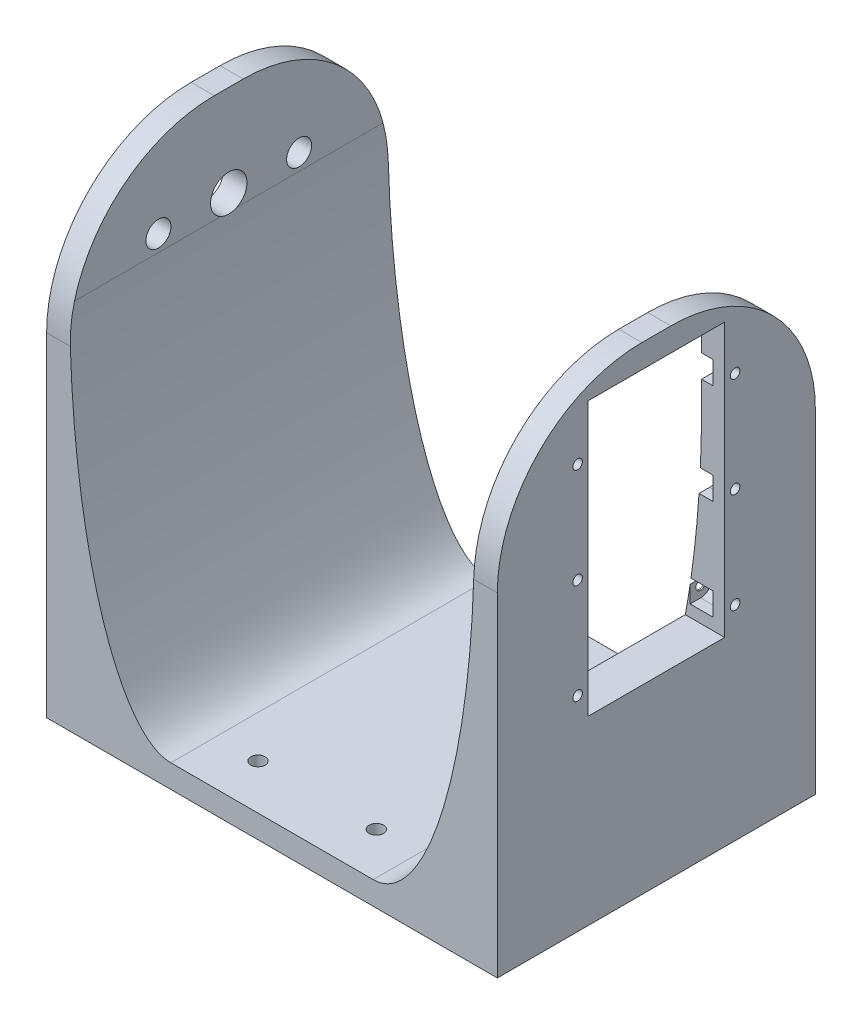
from build123d import *

# Parameters (mm, degrees)
SKETCH1_W               = 99
SKETCH1_H               = 69.85
BOSS_EXTRUDE1_DEPTH     = 105
CUT_EXTRUDE1_DEPTH      = 136.477941009
CUT_EXTRUDE2_REACH      = 123.223
SKETCH3_R               = 1.5875
FILLET1_R               = 31.75
CUT_EXTRUDE3_REACH      = 150.478
SKETCH4_R               = 1.05
SKETCH4_W               = 30
SKETCH4_H               = 60
CUT_EXTRUDE4_REACH      = 150.478
SKETCH6_R               = 4
SKETCH6_R_2             = 2.75
CUT_EXTRUDE5_DEPTH      = 2.5
CUT_EXTRUDE5_DEPTH_BACK = 2.5


with BuildPart() as part:
    # Sketch1 → Boss-Extrude1 (new body)
    with BuildSketch(Plane(origin=(0, 0, 0), x_dir=(1, 0, 0), z_dir=(0, 1, 0))):
        Rectangle(SKETCH1_W, SKETCH1_H)
    extrude(amount=BOSS_EXTRUDE1_DEPTH)

    # Sketch2 → Cut-Extrude1 (cut, through all)
    with BuildSketch(Plane.XY.offset(34.925)):
        with BuildLine():
            Line((-44.42, 105), (44.42, 105))
            Line((44.42, 105), (44.42, 81.28))
            add(Edge.make_bspline(
                [(22.225, 5.08), (44.42, 5.08), (44.42, 81.28)],
                knots=[0, 0, 0, 1.570796327, 1.570796327, 1.570796327], degree=2, weights=[1, 0.707106781, 1]))
            Line((22.225, 5.08), (-22.225, 5.08))
            add(Edge.make_bspline(
                [(-44.42, 81.28), (-44.42, 5.08), (-22.225, 5.08)],
                knots=[1.570796327, 1.570796327, 1.570796327, 3.141592654, 3.141592654, 3.141592654], degree=2, weights=[1, 0.707106781, 1]))
            Line((-44.42, 81.28), (-44.42, 105))
        make_face()
    extrude(amount=-CUT_EXTRUDE1_DEPTH, mode=Mode.SUBTRACT)

    # Sketch3 → Cut-Extrude2 (cut, up to next)
    with BuildSketch(Plane.XZ, mode=Mode.PRIVATE) as cut_extrude2_sk1:
        with Locations((-13, -25)):
            Circle(SKETCH3_R)
    cut_extrude2_tool1 = extrude(cut_extrude2_sk1.sketch, amount=-CUT_EXTRUDE2_REACH, mode=Mode.PRIVATE) & part.part
    # Sketch3 → Cut-Extrude2 (cut, up to next)
    with BuildSketch(Plane.XZ, mode=Mode.PRIVATE) as cut_extrude2_sk2:
        with Locations((-13, 25)):
            Circle(SKETCH3_R)
    cut_extrude2_tool2 = extrude(cut_extrude2_sk2.sketch, amount=-CUT_EXTRUDE2_REACH, mode=Mode.PRIVATE) & part.part
    # Sketch3 → Cut-Extrude2 (cut, up to next)
    with BuildSketch(Plane.XZ, mode=Mode.PRIVATE) as cut_extrude2_sk3:
        with Locations((13, 25)):
            Circle(SKETCH3_R)
    cut_extrude2_tool3 = extrude(cut_extrude2_sk3.sketch, amount=-CUT_EXTRUDE2_REACH, mode=Mode.PRIVATE) & part.part
    # Sketch3 → Cut-Extrude2 (cut, up to next)
    with BuildSketch(Plane.XZ, mode=Mode.PRIVATE) as cut_extrude2_sk4:
        with Locations((13, -25)):
            Circle(SKETCH3_R)
    cut_extrude2_tool4 = extrude(cut_extrude2_sk4.sketch, amount=-CUT_EXTRUDE2_REACH, mode=Mode.PRIVATE) & part.part
    add(cut_extrude2_tool1.solids().sort_by_distance((-13, 0, -25))[0], mode=Mode.SUBTRACT)
    add(cut_extrude2_tool2.solids().sort_by_distance((-13, 0, 25))[0], mode=Mode.SUBTRACT)
    add(cut_extrude2_tool3.solids().sort_by_distance((13, 0, 25))[0], mode=Mode.SUBTRACT)
    add(cut_extrude2_tool4.solids().sort_by_distance((13, 0, -25))[0], mode=Mode.SUBTRACT)

    # Fillet1
    fillet1_edges = [part.edges().sort_by_distance(p)[0] for p in [
        (46.96, 105, 34.925),
        (-46.96, 105, 34.925),
        (-46.96, 105, -34.925),
        (46.96, 105, -34.925),
    ]]
    fillet(fillet1_edges, radius=FILLET1_R)

    # Sketch4 → Cut-Extrude3 (cut, up to next)
    with BuildSketch(Plane(origin=(49.5, 0, 0), x_dir=(0, 0, -1), z_dir=(1, 0, 0)), mode=Mode.PRIVATE) as cut_extrude3_sk1:
        with Locations((-17.3, 88.9)):
            Circle(SKETCH4_R)
    cut_extrude3_tool1 = extrude(cut_extrude3_sk1.sketch, amount=-CUT_EXTRUDE3_REACH, mode=Mode.PRIVATE) & part.part
    # Sketch4 → Cut-Extrude3 (cut, up to next)
    with BuildSketch(Plane(origin=(49.5, 0, 0), x_dir=(0, 0, -1), z_dir=(1, 0, 0)), mode=Mode.PRIVATE) as cut_extrude3_sk2:
        with Locations((-17.3, 66.9)):
            Circle(SKETCH4_R)
    cut_extrude3_tool2 = extrude(cut_extrude3_sk2.sketch, amount=-CUT_EXTRUDE3_REACH, mode=Mode.PRIVATE) & part.part
    # Sketch4 → Cut-Extrude3 (cut, up to next)
    with BuildSketch(Plane(origin=(49.5, 0, 0), x_dir=(0, 0, -1), z_dir=(1, 0, 0)), mode=Mode.PRIVATE) as cut_extrude3_sk3:
        with Locations((-17.3, 44.9)):
            Circle(SKETCH4_R)
    cut_extrude3_tool3 = extrude(cut_extrude3_sk3.sketch, amount=-CUT_EXTRUDE3_REACH, mode=Mode.PRIVATE) & part.part
    # Sketch4 → Cut-Extrude3 (cut, up to next)
    with BuildSketch(Plane(origin=(49.5, 0, 0), x_dir=(0, 0, -1), z_dir=(1, 0, 0)), mode=Mode.PRIVATE) as cut_extrude3_sk4:
        with Locations((17.3, 44.9)):
            Circle(SKETCH4_R)
    cut_extrude3_tool4 = extrude(cut_extrude3_sk4.sketch, amount=-CUT_EXTRUDE3_REACH, mode=Mode.PRIVATE) & part.part
    # Sketch4 → Cut-Extrude3 (cut, up to next)
    with BuildSketch(Plane(origin=(49.5, 0, 0), x_dir=(0, 0, -1), z_dir=(1, 0, 0)), mode=Mode.PRIVATE) as cut_extrude3_sk5:
        with Locations((17.3, 66.9)):
            Circle(SKETCH4_R)
    cut_extrude3_tool5 = extrude(cut_extrude3_sk5.sketch, amount=-CUT_EXTRUDE3_REACH, mode=Mode.PRIVATE) & part.part
    # Sketch4 → Cut-Extrude3 (cut, up to next)
    with BuildSketch(Plane(origin=(49.5, 0, 0), x_dir=(0, 0, -1), z_dir=(1, 0, 0)), mode=Mode.PRIVATE) as cut_extrude3_sk6:
        with Locations((17.3, 88.9)):
            Circle(SKETCH4_R)
    cut_extrude3_tool6 = extrude(cut_extrude3_sk6.sketch, amount=-CUT_EXTRUDE3_REACH, mode=Mode.PRIVATE) & part.part
    # Sketch4 → Cut-Extrude3 (cut, up to next)
    with BuildSketch(Plane(origin=(49.5, 0, 0), x_dir=(0, 0, -1), z_dir=(1, 0, 0)), mode=Mode.PRIVATE) as cut_extrude3_sk7:
        with Locations((0, 69.82)):
            Rectangle(SKETCH4_W, SKETCH4_H)
    cut_extrude3_tool7 = extrude(cut_extrude3_sk7.sketch, amount=-CUT_EXTRUDE3_REACH, mode=Mode.PRIVATE) & part.part
    add(cut_extrude3_tool1.solids().sort_by_distance((49.5, 88.9, 17.3))[0], mode=Mode.SUBTRACT)
    add(cut_extrude3_tool2.solids().sort_by_distance((49.5, 66.9, 17.3))[0], mode=Mode.SUBTRACT)
    add(cut_extrude3_tool3.solids().sort_by_distance((49.5, 44.9, 17.3))[0], mode=Mode.SUBTRACT)
    add(cut_extrude3_tool4.solids().sort_by_distance((49.5, 44.9, -17.3))[0], mode=Mode.SUBTRACT)
    add(cut_extrude3_tool5.solids().sort_by_distance((49.5, 66.9, -17.3))[0], mode=Mode.SUBTRACT)
    add(cut_extrude3_tool6.solids().sort_by_distance((49.5, 88.9, -17.3))[0], mode=Mode.SUBTRACT)
    add(cut_extrude3_tool7.solids().sort_by_distance((49.5, 69.82, 0))[0], mode=Mode.SUBTRACT)

    # Sketch6 → Cut-Extrude4 (cut, up to next)
    with BuildSketch(Plane.ZY.offset(49.5), mode=Mode.PRIVATE) as cut_extrude4_sk1:
        with Locations((0, 84.9)):
            Circle(SKETCH6_R)
    cut_extrude4_tool1 = extrude(cut_extrude4_sk1.sketch, amount=-CUT_EXTRUDE4_REACH, mode=Mode.PRIVATE) & part.part
    # Sketch6 → Cut-Extrude4 (cut, up to next)
    with BuildSketch(Plane.ZY.offset(49.5), mode=Mode.PRIVATE) as cut_extrude4_sk2:
        with Locations((-15.45, 84.9)):
            Circle(SKETCH6_R_2)
    cut_extrude4_tool2 = extrude(cut_extrude4_sk2.sketch, amount=-CUT_EXTRUDE4_REACH, mode=Mode.PRIVATE) & part.part
    # Sketch6 → Cut-Extrude4 (cut, up to next)
    with BuildSketch(Plane.ZY.offset(49.5), mode=Mode.PRIVATE) as cut_extrude4_sk3:
        with Locations((15.45, 84.9)):
            Circle(SKETCH6_R_2)
    cut_extrude4_tool3 = extrude(cut_extrude4_sk3.sketch, amount=-CUT_EXTRUDE4_REACH, mode=Mode.PRIVATE) & part.part
    add(cut_extrude4_tool1.solids().sort_by_distance((-49.5, 84.9, 0))[0], mode=Mode.SUBTRACT)
    add(cut_extrude4_tool2.solids().sort_by_distance((-49.5, 84.9, -15.45))[0], mode=Mode.SUBTRACT)
    add(cut_extrude4_tool3.solids().sort_by_distance((-49.5, 84.9, 15.45))[0], mode=Mode.SUBTRACT)

    # Sketch7 → Cut-Extrude5 (cut, two sides: drawn at the far end of the back side and taken through both)
    with BuildSketch(Plane.ZY.offset(-44.42).offset(-CUT_EXTRUDE5_DEPTH_BACK)):
        with BuildLine():
            Line((-17.3, 91.4), (-15, 91.4))
            Line((-15, 91.4), (-15, 86.4))
            Line((-15, 86.4), (-17.3, 86.4))
            ThreePointArc((-17.3, 86.4), (-19.8, 88.9), (-17.3, 91.4))
        make_face()
        with BuildLine():
            Line((-17.3, 69.4), (-15, 69.4))
            Line((-15, 69.4), (-15, 64.4))
            Line((-15, 64.4), (-17.3, 64.4))
            ThreePointArc((-17.3, 64.4), (-19.8, 66.9), (-17.3, 69.4))
        make_face()
        with BuildLine():
            Line((-17.3, 47.4), (-15, 47.4))
            Line((-15, 47.4), (-15, 42.4))
            Line((-15, 42.4), (-17.3, 42.4))
            ThreePointArc((-17.3, 42.4), (-19.8, 44.9), (-17.3, 47.4))
        make_face()
        with BuildLine():
            Line((17.3, 47.4), (15, 47.4))
            Line((15, 47.4), (15, 42.4))
            Line((15, 42.4), (17.3, 42.4))
            ThreePointArc((17.3, 42.4), (19.8, 44.9), (17.3, 47.4))
        make_face()
        with BuildLine():
            Line((17.3, 69.4), (15, 69.4))
            Line((15, 69.4), (15, 64.4))
            Line((15, 64.4), (17.3, 64.4))
            ThreePointArc((17.3, 64.4), (19.8, 66.9), (17.3, 69.4))
        make_face()
        with BuildLine():
            Line((17.3, 91.4), (15, 91.4))
            Line((15, 91.4), (15, 86.4))
            Line((15, 86.4), (17.3, 86.4))
            ThreePointArc((17.3, 86.4), (19.8, 88.9), (17.3, 91.4))
        make_face()
    extrude(amount=CUT_EXTRUDE5_DEPTH + CUT_EXTRUDE5_DEPTH_BACK, mode=Mode.SUBTRACT)


solid = part.part
